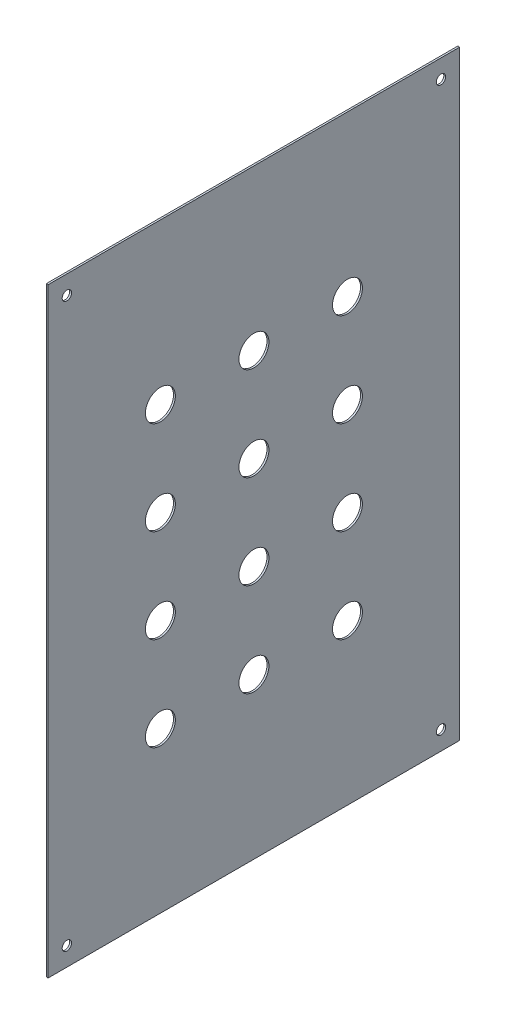
from build123d import *

# Parameters (mm, degrees)
SKETCH1_W           = 321
SKETCH1_H           = 220
BOSS_EXTRUDE1_DEPTH = 1
SKETCH2_R           = 8
CUT_EXTRUDE1_DEPTH  = 195.579675198
SKETCH3_R           = 2.5
CUT_EXTRUDE2_DEPTH  = 195.579675198


with BuildPart() as part:
    # Sketch1 → Boss-Extrude1 (new body)
    with BuildSketch(Plane.YZ):
        Rectangle(SKETCH1_W, SKETCH1_H)
    extrude(amount=BOSS_EXTRUDE1_DEPTH)

    # Sketch2 → Cut-Extrude1 (cut, through all)
    with BuildSketch(Plane.YZ.offset(1)):
        with Locations((-75, 50)):
            Circle(SKETCH2_R)
        with Locations((-25, 50)):
            Circle(SKETCH2_R)
        with Locations((25, 50)):
            Circle(SKETCH2_R)
        with Locations((75, 50)):
            Circle(SKETCH2_R)
        with Locations((-25, 0)):
            Circle(SKETCH2_R)
        with Locations((25, 0)):
            Circle(SKETCH2_R)
        with Locations((75, 0)):
            Circle(SKETCH2_R)
        with Locations((-25, -50)):
            Circle(SKETCH2_R)
        with Locations((25, -50)):
            Circle(SKETCH2_R)
        with Locations((75, -50)):
            Circle(SKETCH2_R)
        with Locations((-75, 0)):
            Circle(SKETCH2_R)
        with Locations((-75, -50)):
            Circle(SKETCH2_R)
    extrude(amount=-CUT_EXTRUDE1_DEPTH, mode=Mode.SUBTRACT)

    # Sketch3 → Cut-Extrude2 (cut, through all)
    with BuildSketch(Plane.YZ.offset(1)):
        with Locations((-150.5, 100)):
            Circle(SKETCH3_R)
        with Locations((150.5, 100)):
            Circle(SKETCH3_R)
        with Locations((-150.5, -100)):
            Circle(SKETCH3_R)
        with Locations((150.5, -100)):
            Circle(SKETCH3_R)
    extrude(amount=-CUT_EXTRUDE2_DEPTH, mode=Mode.SUBTRACT)


solid = part.part
